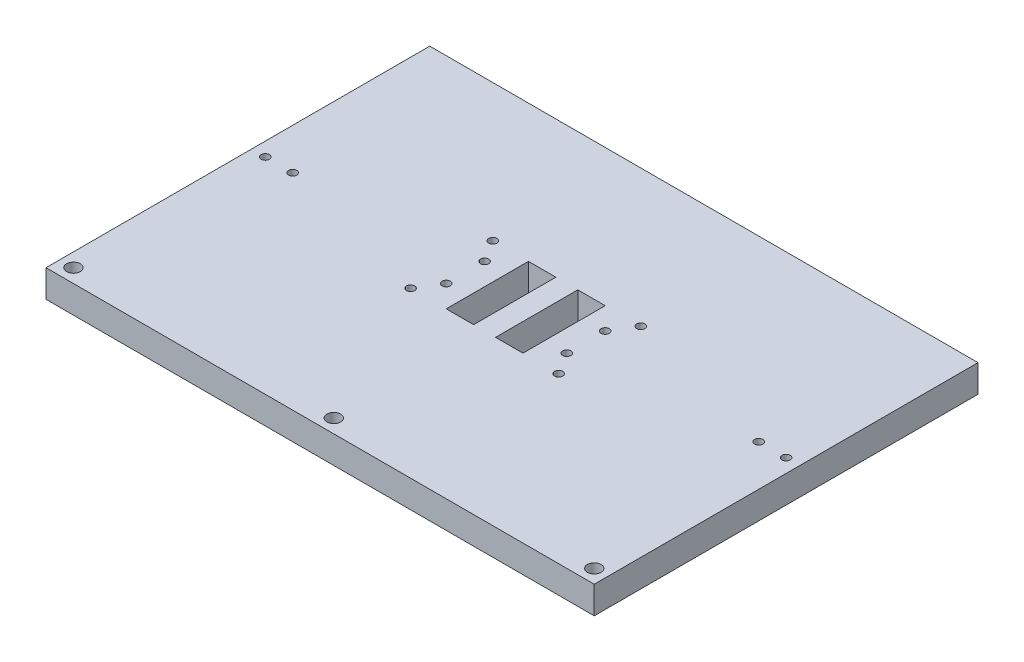
from build123d import *

# Parameters (mm, degrees)
SKETCH1_W           = 200
SKETCH1_H           = 60
BOSS_EXTRUDE1_DEPTH = 10
SKETCH2_W           = 200
SKETCH2_H           = 10
BOSS_EXTRUDE2_DEPTH = 130
SKETCH3_R           = 15.5
CUT_EXTRUDE1_DEPTH  = 60
SKETCH7_W           = 10
SKETCH7_H           = 30
CUT_EXTRUDE4_DEPTH  = 30
SKETCH9_R           = 1.5
SKETCH9_R_2         = 2.5
CUT_EXTRUDE6_DEPTH  = 20
SKETCH10_W          = 33.76561095
SKETCH10_H          = 62.627783557
CUT_EXTRUDE7_DEPTH  = 130


with BuildPart() as part:
    # Sketch1 → Boss-Extrude1 (new body)
    with BuildSketch(Plane.XY):
        Rectangle(SKETCH1_W, SKETCH1_H)
    extrude(amount=BOSS_EXTRUDE1_DEPTH)

    # Sketch2 → Boss-Extrude2 (add)
    with BuildSketch(Plane(origin=(0, 0, 0), x_dir=(-1, 0, 0), z_dir=(0, 0, -1))):
        with Locations((0, -25)):
            Rectangle(SKETCH2_W, SKETCH2_H)
    extrude(amount=BOSS_EXTRUDE2_DEPTH)

    # Sketch3 → Cut-Extrude1 (cut)
    with BuildSketch(Plane.XY.offset(10)):
        with Locations((0, 5)):
            Circle(SKETCH3_R)
        with Locations((60, 5)):
            Circle(SKETCH3_R)
        with Locations((-60, 5)):
            Circle(SKETCH3_R)
    extrude(amount=-CUT_EXTRUDE1_DEPTH, mode=Mode.SUBTRACT)

    # Sketch7 → Cut-Extrude4 (cut)
    with BuildSketch(Plane(origin=(0, -20, 0), x_dir=(1, 0, 0), z_dir=(0, 1, 0))):
        with Locations((9, 65)):
            Rectangle(SKETCH7_W, SKETCH7_H)
        with Locations((-9, 65)):
            Rectangle(SKETCH7_W, SKETCH7_H)
    extrude(amount=-CUT_EXTRUDE4_DEPTH, mode=Mode.SUBTRACT)

    # Sketch9 → Cut-Extrude6 (cut)
    with BuildSketch(Plane(origin=(0, -20, 0), x_dir=(1, 0, 0), z_dir=(0, 1, 0))):
        with Locations((-27, 80)):
            Circle(SKETCH9_R)
        with Locations((27, 80)):
            Circle(SKETCH9_R)
        with Locations((27, 50)):
            Circle(SKETCH9_R)
        with Locations((-27, 50)):
            Circle(SKETCH9_R)
        with Locations((-22, 72)):
            Circle(SKETCH9_R)
        with Locations((-22, 58)):
            Circle(SKETCH9_R)
        with Locations((22, 72)):
            Circle(SKETCH9_R)
        with Locations((22, 58)):
            Circle(SKETCH9_R)
        with Locations((0, -5)):
            Circle(SKETCH9_R_2)
        with Locations((95, -5)):
            Circle(SKETCH9_R_2)
        with Locations((-95, -5)):
            Circle(SKETCH9_R_2)
        with Locations((95, 65)):
            Circle(SKETCH9_R)
        with Locations((85, 65)):
            Circle(SKETCH9_R)
        with Locations((-85, 65)):
            Circle(SKETCH9_R)
        with Locations((-95, 65)):
            Circle(SKETCH9_R)
    extrude(amount=-CUT_EXTRUDE6_DEPTH, mode=Mode.SUBTRACT)

    # Sketch10 → Cut-Extrude7 (cut, symmetric)
    with BuildSketch(Plane(origin=(0, 0, 0), x_dir=(0, 0, -1), z_dir=(1, 0, 0))):
        with Locations((-16.882805475, 11.313891779)):
            Rectangle(SKETCH10_W, SKETCH10_H)
    extrude(amount=CUT_EXTRUDE7_DEPTH, both=True, mode=Mode.SUBTRACT)


solid = part.part
